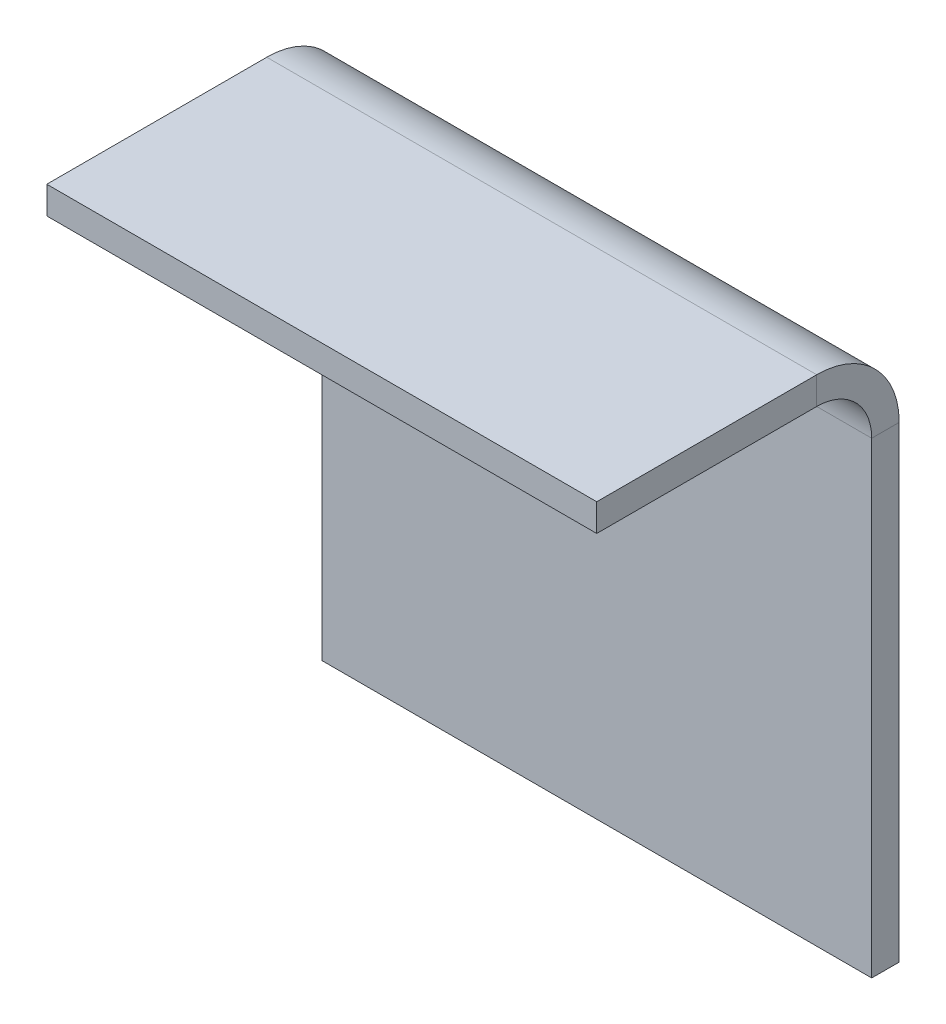
from build123d import *

# Parameters (mm, degrees)
SKETCH_1_W            = 20
SKETCH_1_H            = 10
BASEPLATE_DEPTH       = 1
EDGEFLANGE_DEPTH      = 20
EDGEFLANGE_FLAT_DEPTH = 1


# Sheet-metal steps are written as plain solids
with BuildPart() as part:
    # Sketch 1 → BasePlate (new body)
    with BuildSketch(Plane.XY):
        with Locations((10, 5)):
            Rectangle(SKETCH_1_W, SKETCH_1_H)
    extrude(amount=-BASEPLATE_DEPTH)

    # EdgeFlange bend section (across the edge) → EdgeFlange (add)
    with BuildSketch(Plane(origin=(20, 20, 0), x_dir=(0, -1, 0), z_dir=(-1, 0, 0))):
        with BuildLine():
            Line((0, 2), (1, 2))
            ThreePointArc((1, 2), (1.585786438, 0.585786438), (3, 0))
            Line((3, 0), (10, 0))
            Line((10, 0), (10, -1))
            Line((10, -1), (3, -1))
            ThreePointArc((3, -1), (0.878679656, -0.121320344), (0, 2))
        make_face()
    extrude(amount=EDGEFLANGE_DEPTH)

    # EdgeFlange profile (on flange) → EdgeFlange flat (add)
    with BuildSketch(Plane(origin=(0, 20, 0), x_dir=(-1, 0, 0), z_dir=(0, 1, 0))):
        Polygon((-20, 10), (-20, 2), (0, 2), (0, 10), (-2, 10), (-18, 10), align=None)
    extrude(amount=-EDGEFLANGE_FLAT_DEPTH)


solid = part.part
